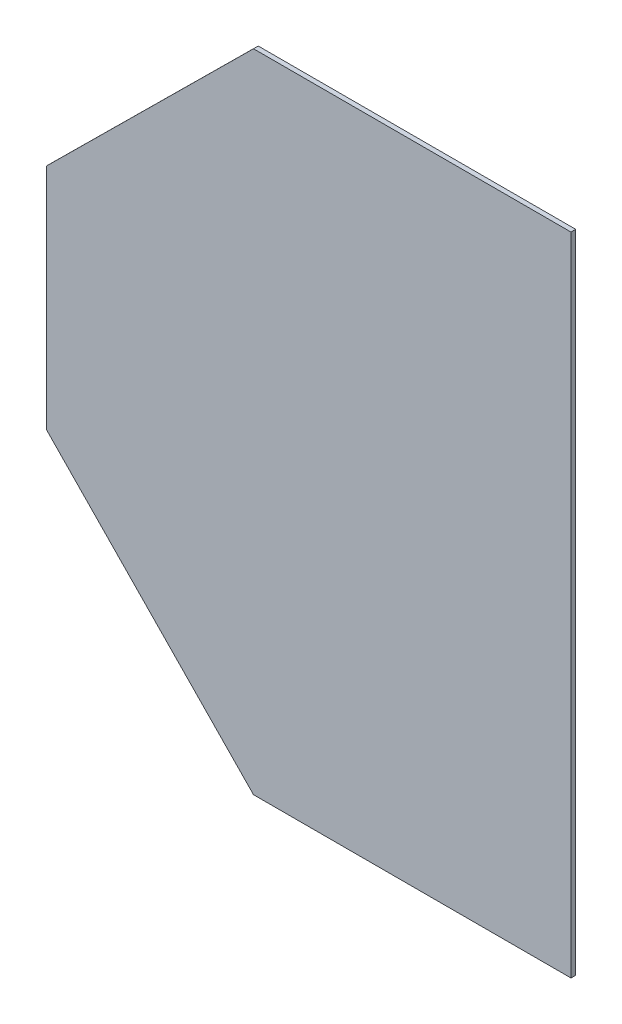
from build123d import *

# Parameters (mm, degrees)
BOSS_EXTRUDE1_DEPTH = 3.175


with BuildPart() as part:
    # Sketch1 → Boss-Extrude1 (new body)
    with BuildSketch(Plane.XY):
        Polygon((-4.280950931, -146.790318846), (-216.488062196, -146.790318846), (-354.995654443, -4.562065129), (-354.995654443, 147.837934871), (-216.488062196, 285.009681154), (-4.280950931, 285.009681154), align=None)
    extrude(amount=BOSS_EXTRUDE1_DEPTH)


solid = part.part
